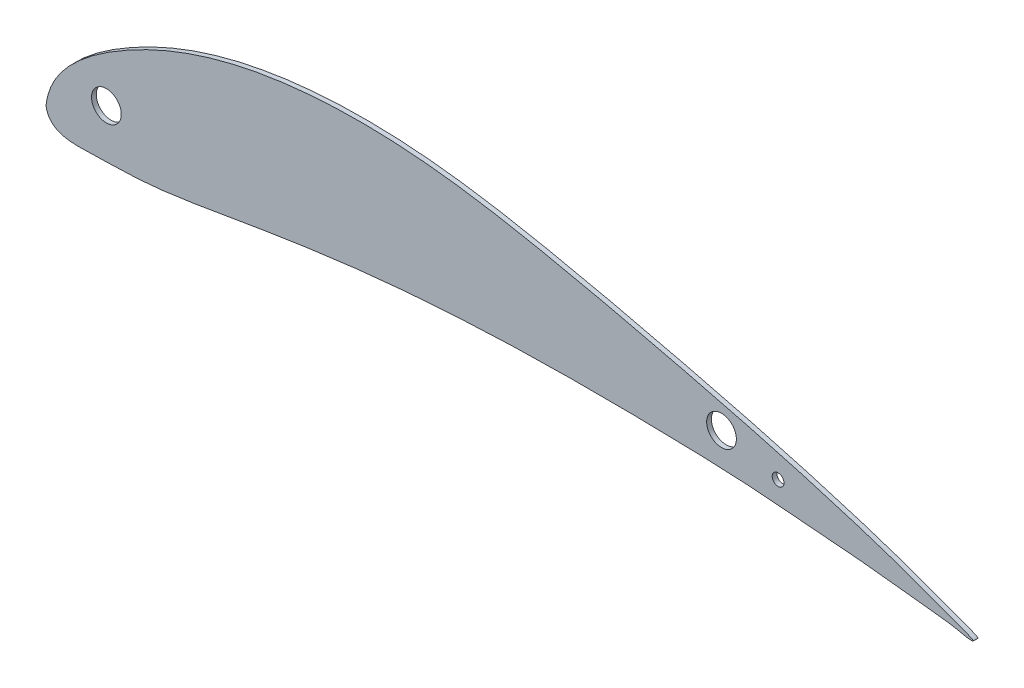
from build123d import *

# Parameters (mm, degrees)
BOSS_EXTRUDE1_DEPTH = 1.5875
SKETCH2_R           = 5
SKETCH2_R_2         = 1.984375
CUT_EXTRUDE1_DEPTH  = 316.731983488


with BuildPart() as part:
    # Sketch1 → Boss-Extrude1 (new body)
    with BuildSketch(Plane.XY):
        with BuildLine():
            add(Edge.make_bspline(
                [(0.000560351, 0.000130087), (0.810633127, 7.359196055), (8.649092025, 17.856605174), (26.286719818, 29.975176328), (52.111128271, 42.069215275), (89.597618475, 49.290763054), (131.400792109, 47.884831915), (173.256699242, 40.041104278), (217.961060472, 29.612974894), (256.952064401, 19.528920948), (290.35983767, 8.71099439), (301.273197721, 4.382828139), (314.816918223, -0.516206742), (309.846313895, 0.000130087)],
                knots=[0, 0, 0, 0, 0.060863618, 0.113688265, 0.188608742, 0.312908923, 0.448482434, 0.557612135, 0.691544113, 0.852438279, 0.92975597, 0.976058229, 1, 1, 1, 1], degree=3))
            add(Edge.make_bspline(
                [(309.846313895, 0.000130087), (303.956832565, 1.47095521), (293.989507544, 2.093987313), (276.26402299, 4.514356704), (260.846344817, 5.427413394), (235.858814759, 7.870306192), (205.101424636, 8.838080282), (157.718638092, 9.030650149), (110.497331172, 6.181495223), (66.506197185, -0.586669107), (36.454672816, -6.098499901), (15.316603331, -6.189065841), (1.230714189, -6.924076091), (0.000560351, 0.000130087)],
                knots=[0, 0, 0, 0, 0.057787081, 0.095274891, 0.171021118, 0.205339302, 0.335319146, 0.464904334, 0.658702312, 0.785511947, 0.893517288, 0.94309214, 1, 1, 1, 1], degree=3))
        make_face()
    extrude(amount=BOSS_EXTRUDE1_DEPTH)

    # Sketch2 → Cut-Extrude1 (cut, through all)
    with BuildSketch(Plane.XY.offset(1.5875)):
        with Locations((20.32, 10.16)):
            Circle(SKETCH2_R)
        with Locations((227.296313895, 19.050130087)):
            Circle(SKETCH2_R)
        with Locations((246.346313895, 14.224130087)):
            Circle(SKETCH2_R_2)
    extrude(amount=-CUT_EXTRUDE1_DEPTH, mode=Mode.SUBTRACT)


solid = part.part
